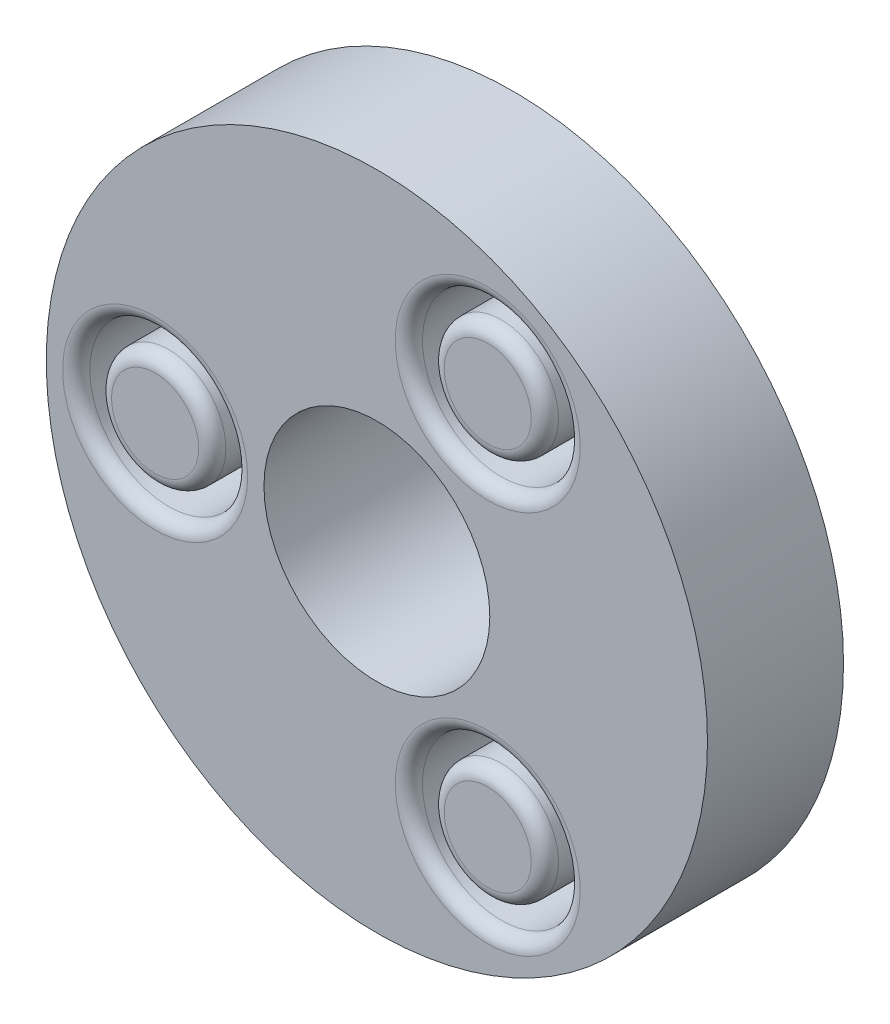
from build123d import *

# Parameters (mm, degrees)
SKETCH1_R           = 6
SKETCH1_R_2         = 4.15
BOSS_EXTRUDE1_DEPTH = 2
SKETCH2_R           = 12.15
SKETCH2_R_2         = 4.15
BOSS_EXTRUDE2_DEPTH = 5
SKETCH3_R           = 2.9
SKETCH3_R_2         = 2.1
CUT_EXTRUDE1_DEPTH  = 4
FILLET1_R           = 0.5
CHAMFER1_SIZE       = 2


with BuildPart() as part:
    # Sketch1 → Boss-Extrude1 (new body)
    with BuildSketch(Plane.XY):
        Circle(SKETCH1_R)
        Circle(SKETCH1_R_2, mode=Mode.SUBTRACT)
    extrude(amount=BOSS_EXTRUDE1_DEPTH)

    # Sketch2 → Boss-Extrude2 (add)
    with BuildSketch(Plane.XY.offset(2)):
        Circle(SKETCH2_R)
        Circle(SKETCH2_R_2, mode=Mode.SUBTRACT)
    extrude(amount=BOSS_EXTRUDE2_DEPTH)

    # Sketch3 → Cut-Extrude1 (cut)
    # profile 1 of 3: a face of its own
    with BuildSketch(Plane.XY.offset(7)):
        with Locations((-8.15, 0)):
            Circle(SKETCH3_R)
        with Locations((-8.15, 0)):
            Circle(SKETCH3_R_2, mode=Mode.SUBTRACT)
    # profile 2 of 3: a face of its own
    with BuildSketch(Plane.XY.offset(7)):
        with Locations((4.075, 7.058107041)):
            Circle(SKETCH3_R)
        with Locations((4.075, 7.058107041)):
            Circle(SKETCH3_R_2, mode=Mode.SUBTRACT)
    # profile 3 of 3: a face of its own
    with BuildSketch(Plane.XY.offset(7)):
        with Locations((4.075, -7.058107041)):
            Circle(SKETCH3_R)
        with Locations((4.075, -7.058107041)):
            Circle(SKETCH3_R_2, mode=Mode.SUBTRACT)
    extrude(amount=-CUT_EXTRUDE1_DEPTH, mode=Mode.SUBTRACT)

    # Fillet1
    fillet1_edges = [part.edges().sort_by_distance(p)[0] for p in [
        (-11.05, 0, 7),
        (-10.25, 0, 7),
        (1.175, 7.058107041, 7),
        (1.975, 7.058107041, 7),
        (1.175, -7.058107041, 7),
        (1.975, -7.058107041, 7),
    ]]
    fillet(fillet1_edges, radius=FILLET1_R)

    # Chamfer1
    chamfer1_edges = [part.edges().sort_by_distance(p)[0] for p in [
        (-6, 0, 2),
    ]]
    chamfer(chamfer1_edges, length=CHAMFER1_SIZE - 0.0001)  # a hair under: the kernel refuses the full size


solid = part.part
